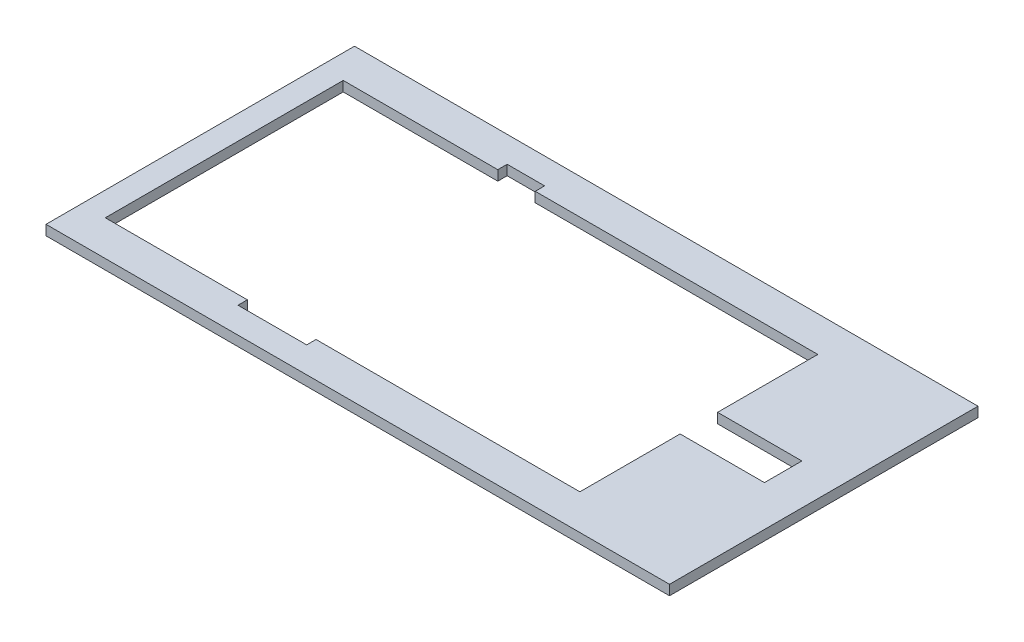
from build123d import *

# Parameters (mm, degrees)
SKETCH1_W           = 199.69
SKETCH1_H           = 98.8
BOSS_EXTRUDE1_DEPTH = 3.2


with BuildPart() as part:
    # Sketch1 → Boss-Extrude1 (new body)
    with BuildSketch(Plane(origin=(0, 0, 0), x_dir=(1, 0, 0), z_dir=(0, 1, 0))):
        with Locations((47.069273279, -22.280892524)):
            Rectangle(SKETCH1_W, SKETCH1_H)
        Polygon((-45.085726721, 15.819107476), (4.414273279, 15.819107476), (4.414273279, 18.819107476), (16.414273279, 18.819107476), (16.414273279, 15.819107476), (106.914273279, 15.819107476), (106.914273279, -16.280892524), (133.914273279, -16.280892524), (133.914273279, -28.280892524), (106.914273279, -28.280892524), (106.914273279, -60.380892524), (22.414273279, -60.380892524), (22.414273279, -63.380892524), (0.414273279, -63.380892524), (0.414273279, -60.380892524), (-45.085726721, -60.380892524), align=None, mode=Mode.SUBTRACT)
    extrude(amount=BOSS_EXTRUDE1_DEPTH)


solid = part.part
